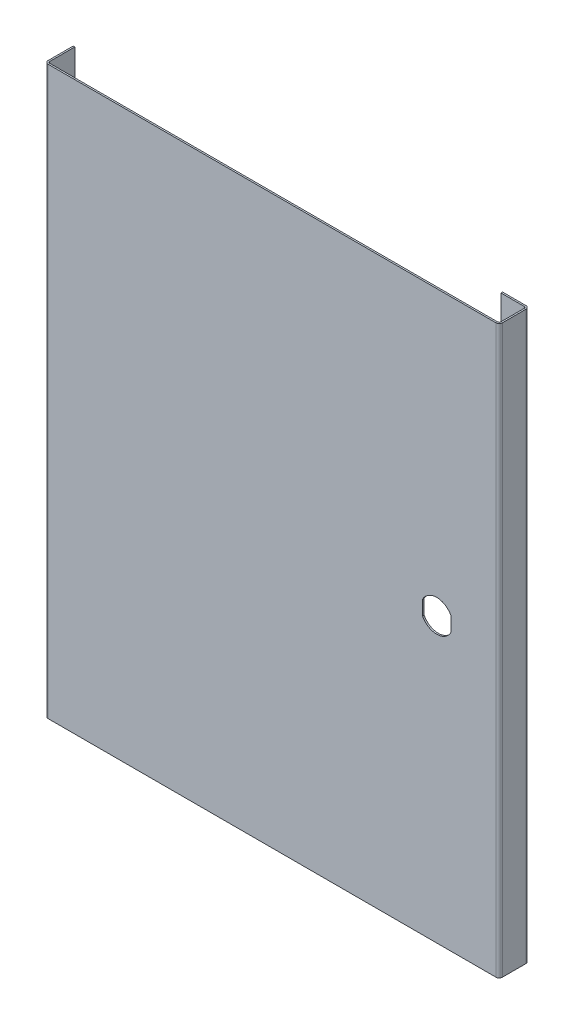
from build123d import *

# Parameters (mm, degrees)
SKETCH1_W                      = 256.5
SKETCH1_H                      = 320
BASE_FLANGE1_DEPTH             = 0.9
EDGE_FLANGE1_STRIP_W           = 5.4
EDGE_FLANGE1_STRIP_H           = 0.9
EDGE_FLANGE1_STRIP_CUT_DEPTH   = 320
EDGE_FLANGE1_STRIP_2_W         = 5.4
EDGE_FLANGE1_STRIP_2_H         = 0.9
EDGE_FLANGE1_STRIP_CUT_2_DEPTH = 320
EDGE_FLANGE1_DEPTH             = 320
EDGE_FLANGE1_BEND_DEPTH        = 320
EDGE_FLANGE2_STRIP_W           = 5.4
EDGE_FLANGE2_STRIP_H           = 0.9
EDGE_FLANGE2_STRIP_CUT_DEPTH   = 320
EDGE_FLANGE2_DEPTH             = 320
CUT_EXTRUDE1_DEPTH             = 206.751482376


# Sheet-metal steps are written as plain solids
with BuildPart() as part:
    # Sketch1 → Base-Flange1 (new body)
    with BuildSketch(Plane.XY):
        Rectangle(SKETCH1_W, SKETCH1_H)
    extrude(amount=-BASE_FLANGE1_DEPTH)

    # Edge-Flange1 strip (across the edge) → Edge-Flange1 strip cut (cut)
    with BuildSketch(Plane(origin=(128.25, 160, -0.9), x_dir=(-1, 0, 0), z_dir=(0, -1, 0))):
        with Locations((-0.9, -0.45)):
            Rectangle(EDGE_FLANGE1_STRIP_W, EDGE_FLANGE1_STRIP_H)
    extrude(amount=EDGE_FLANGE1_STRIP_CUT_DEPTH, mode=Mode.SUBTRACT)

    # Edge-Flange1 strip 2 (across the edge) → Edge-Flange1 strip cut 2 (cut)
    with BuildSketch(Plane(origin=(-128.25, -160, -0.9), x_dir=(1, 0, 0), z_dir=(0, 1, 0))):
        with Locations((-0.9, -0.45)):
            Rectangle(EDGE_FLANGE1_STRIP_2_W, EDGE_FLANGE1_STRIP_2_H)
    extrude(amount=EDGE_FLANGE1_STRIP_CUT_2_DEPTH, mode=Mode.SUBTRACT)

    # Edge-Flange1 section (across the edge) → Edge-Flange1 (add)
    with BuildSketch(Plane(origin=(128.25, 160, -0.9), x_dir=(-1, 0, 0), z_dir=(0, -1, 0))):
        with BuildLine():
            Line((0, 0.9), (0, 15.1))
            Line((0, 15.1), (0.9, 15.1))
            Line((0.9, 15.1), (0.9, 0.9))
            ThreePointArc((0.9, 0.9), (1.163603897, 0.263603897), (1.8, 0))
            Line((1.8, 0), (1.8, -0.9))
            ThreePointArc((1.8, -0.9), (0.527207794, -0.372792206), (0, 0.9))
        make_face()
    extrude(amount=EDGE_FLANGE1_DEPTH)

    # Edge-Flange1 section 2 (across the edge) → Edge-Flange1 bend (add)
    with BuildSketch(Plane(origin=(-128.25, -160, -0.9), x_dir=(1, 0, 0), z_dir=(0, 1, 0))):
        with BuildLine():
            Line((0, 0.9), (0, 15.1))
            Line((0, 15.1), (0.9, 15.1))
            Line((0.9, 15.1), (0.9, 0.9))
            ThreePointArc((0.9, 0.9), (1.163603897, 0.263603897), (1.8, 0))
            Line((1.8, 0), (1.8, -0.9))
            ThreePointArc((1.8, -0.9), (0.527207794, -0.372792206), (0, 0.9))
        make_face()
    extrude(amount=EDGE_FLANGE1_BEND_DEPTH)

    # Edge-Flange2 strip (across the edge) → Edge-Flange2 strip cut (cut)
    with BuildSketch(Plane(origin=(127.35, 160, -16), x_dir=(0, 0, 1), z_dir=(0, -1, 0))):
        with Locations((-1.8, -0.45)):
            Rectangle(EDGE_FLANGE2_STRIP_W, EDGE_FLANGE2_STRIP_H)
    extrude(amount=EDGE_FLANGE2_STRIP_CUT_DEPTH, mode=Mode.SUBTRACT)

    # Edge-Flange2 section (across the edge) → Edge-Flange2 (add)
    with BuildSketch(Plane(origin=(127.35, 160, -16), x_dir=(0, 0, 1), z_dir=(0, -1, 0))):
        with BuildLine():
            Line((-0.9, 0.9), (-0.9, 14.1))
            Line((-0.9, 14.1), (0, 14.1))
            Line((0, 14.1), (0, 0.9))
            ThreePointArc((0, 0.9), (0.263603897, 0.263603897), (0.9, 0))
            Line((0.9, 0), (0.9, -0.9))
            ThreePointArc((0.9, -0.9), (-0.372792206, -0.372792206), (-0.9, 0.9))
        make_face()
    extrude(amount=EDGE_FLANGE2_DEPTH)

    # Sketch24 → Cut-Extrude1 (cut, through all)
    with BuildSketch(Plane.XY):
        with BuildLine():
            Line((101, 4.123105626), (101, -4.123105626))
            ThreePointArc((101, -4.123105626), (93, -9), (85, -4.123105626))
            Line((85, -4.123105626), (85, 4.123105626))
            ThreePointArc((85, 4.123105626), (93, 9), (101, 4.123105626))
        make_face()
    extrude(amount=-CUT_EXTRUDE1_DEPTH, mode=Mode.SUBTRACT)


solid = part.part
